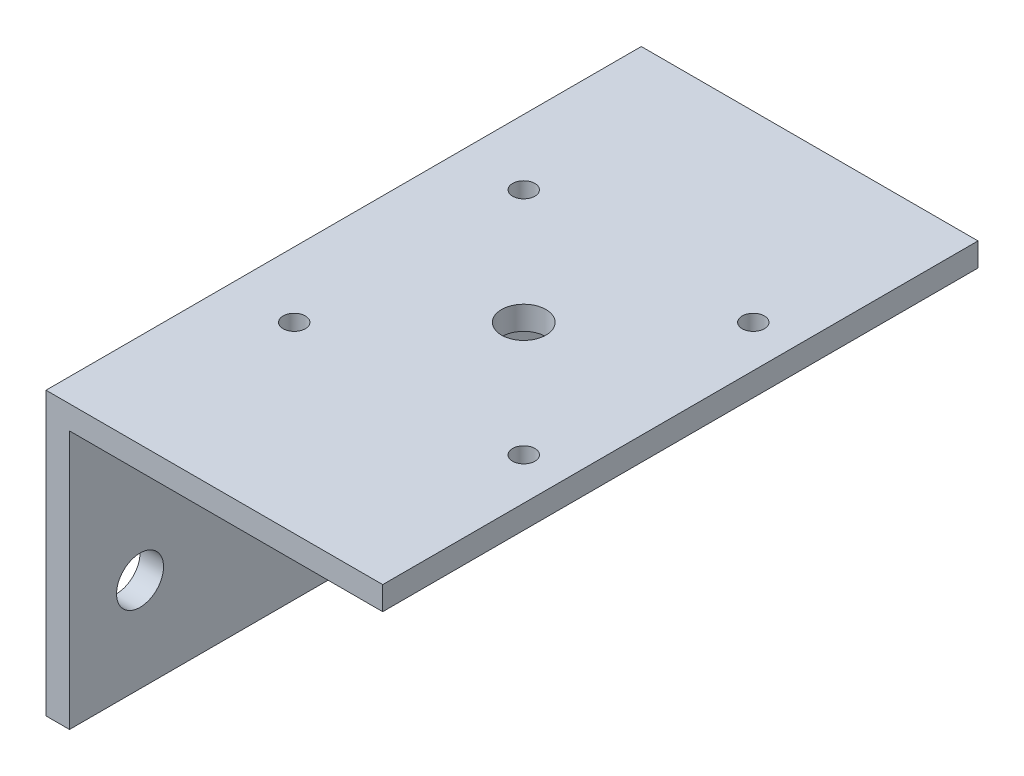
from build123d import *

# Parameters (mm, degrees)
BOSS_EXTRUDE1_DEPTH = 80.4
SKETCH2_R           = 3.175
CUT_EXTRUDE1_DEPTH  = 99.514262927
SKETCH3_R           = 1.5
SKETCH3_R_2         = 3
CUT_EXTRUDE2_DEPTH  = 100.918695073


with BuildPart() as part:
    # Sketch1 → Boss-Extrude1 (new body)
    with BuildSketch(Plane.XY):
        Polygon((0, 0), (3.175, 0), (3.175, 34.925), (45.475, 34.925), (45.475, 38.1), (0, 38.1), align=None)
    extrude(amount=BOSS_EXTRUDE1_DEPTH)

    # Sketch2 → Cut-Extrude1 (cut, through all)
    with BuildSketch(Plane(origin=(3.175, 0, 0), x_dir=(0, 0, -1), z_dir=(1, 0, 0))):
        with Locations((-70.875, 12.7)):
            Circle(SKETCH2_R)
        with Locations((-9.525, 12.7)):
            Circle(SKETCH2_R)
    extrude(amount=-CUT_EXTRUDE1_DEPTH, mode=Mode.SUBTRACT)

    # Sketch3 → Cut-Extrude2 (cut, through all)
    with BuildSketch(Plane(origin=(0, 38.1, 0), x_dir=(1, 0, 0), z_dir=(0, 1, 0))):
        with Locations((39.825, -55.7)):
            Circle(SKETCH3_R)
        with Locations((8.825, -55.7)):
            Circle(SKETCH3_R)
        with Locations((8.825, -24.7)):
            Circle(SKETCH3_R)
        with Locations((39.825, -24.7)):
            Circle(SKETCH3_R)
        with Locations((24.325, -40.2)):
            Circle(SKETCH3_R_2)
    extrude(amount=-CUT_EXTRUDE2_DEPTH, mode=Mode.SUBTRACT)


solid = part.part
